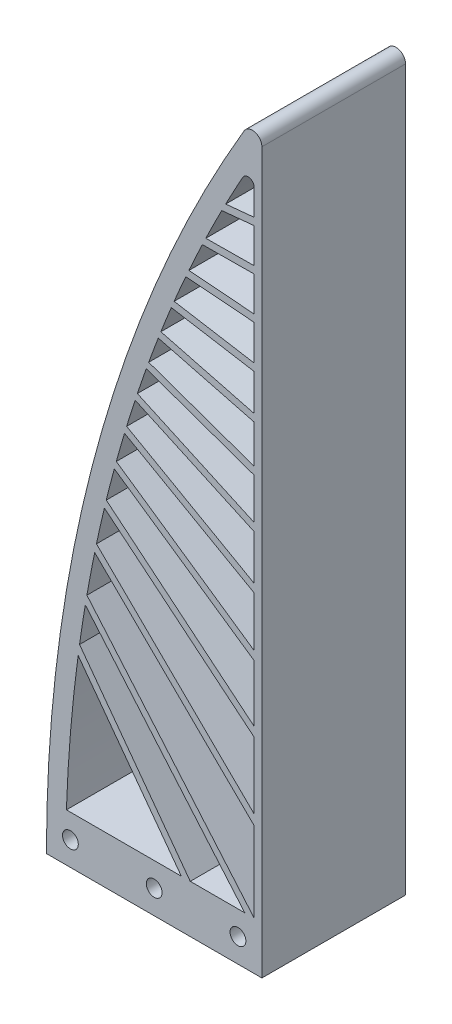
from build123d import *

# Parameters (mm, degrees)
BOSS_EXTRUDE4_DEPTH = 30
SKETCH12_R          = 1.65
CUT_EXTRUDE1_DEPTH  = 162.652709488
BOSS_EXTRUDE5_DEPTH = 30
CIRPATTERN1_DEPTH   = 30
CUT_EXTRUDE2_START  = -30
CUT_EXTRUDE2_DEPTH  = 30


# Read off the part's stored shape, not the designer's step: CirPattern1
with BuildPart() as part:
    # Sketch5 → Boss-Extrude4 (new body)
    with BuildSketch(Plane.XY):
        with BuildLine():
            Line((0, 0), (0, 150.337121164))
            ThreePointArc((0, 150.337121164), (-1.473777529, 152.266652173), (-3.723089911, 151.352483739))
            ThreePointArc((-3.723089911, 151.352483739), (-34.4957159, 78.440037035), (-45, 0))
            Line((-45, 0), (0, 0))
        make_face()
        with BuildLine():
            Line((-1.6, 10), (-40.829955095, 10))
            ThreePointArc((-40.829955095, 10), (-30.304470107, 78.595490327), (-4, 142.815440342))
            ThreePointArc((-4, 142.815440342), (-2.559389376, 143.433276944), (-1.6, 142.193658833))
            Line((-1.6, 142.193658833), (-1.6, 10))
        make_face(mode=Mode.SUBTRACT)
    extrude(amount=BOSS_EXTRUDE4_DEPTH)

    # Sketch12 → Cut-Extrude1 (cut, through all)
    with BuildSketch(Plane.XY.offset(30)):
        with Locations((-40, 5)):
            Circle(SKETCH12_R)
        with Locations((-22.5, 5)):
            Circle(SKETCH12_R)
        with Locations((-5, 5)):
            Circle(SKETCH12_R)
    extrude(amount=-CUT_EXTRUDE1_DEPTH, mode=Mode.SUBTRACT)

    # Sketch13 → Boss-Extrude5 (add)
    with BuildSketch(Plane.XY.offset(30)):
        Polygon((-101.6, 127.193658833), (-1.6, 10), (-2.741055234, 9.026350704), (-102.741055234, 126.220009537), align=None)
    extrude(amount=-BOSS_EXTRUDE5_DEPTH)

    # CirPattern1 outline → CirPattern1 (add)
    with BuildSketch(Plane.XY):
        with BuildLine():
            Line((-101.6, 127.193658833), (-90.428627174, 114.101518276))
            Line((-90.428627174, 114.101518276), (-38.303740092, 62.831561128))
            ThreePointArc((-38.303740092, 62.831561128), (-38.115676892, 63.697596098), (-37.925040114, 64.563068197))
            Line((-37.925040114, 64.563068197), (-89.330082385, 115.124987119))
            Line((-89.330082385, 115.124987119), (-36.32594483, 71.390938936))
            ThreePointArc((-36.32594483, 71.390938936), (-36.125817446, 72.197508487), (-35.923442521, 73.003517048))
            Line((-35.923442521, 73.003517048), (-88.324919079, 116.240305842))
            Line((-88.324919079, 116.240305842), (-34.318662851, 79.086385123))
            ThreePointArc((-34.318662851, 79.086385123), (-34.107234191, 79.850856393), (-33.893772384, 80.614762447))
            Line((-33.893772384, 80.614762447), (-87.420787154, 117.438986195))
            Line((-87.420787154, 117.438986195), (-32.265940677, 86.200502345))
            ThreePointArc((-32.265940677, 86.200502345), (-32.04280883, 86.93581789), (-31.817782431, 87.670555864))
            Line((-31.817782431, 87.670555864), (-86.624567601, 118.711905496))
            Line((-86.624567601, 118.711905496), (-30.142720205, 92.940380431))
            ThreePointArc((-30.142720205, 92.940380431), (-29.906617894, 93.656921246), (-29.668703058, 94.372862284))
            Line((-29.668703058, 94.372862284), (-85.942320131, 120.049376062))
            Line((-85.942320131, 120.049376062), (-27.915909182, 99.471216899))
            ThreePointArc((-27.915909182, 99.471216899), (-27.664777337, 100.177924555), (-27.411868402, 100.883998196))
            Line((-27.411868402, 100.883998196), (-85.379237059, 121.441218934))
            Line((-85.379237059, 121.441218934), (-25.542932289, 105.93724151))
            ThreePointArc((-25.542932289, 105.93724151), (-25.273841569, 106.642396064), (-25.002966495, 107.346867111))
            Line((-25.002966495, 107.346867111), (-84.939603787, 122.876841346))
            Line((-84.939603787, 122.876841346), (-22.968102286, 112.477173218))
            ThreePointArc((-22.968102286, 112.477173218), (-22.677026174, 113.189036497), (-22.384114637, 113.900146519))
            Line((-22.384114637, 113.900146519), (-84.62676619, 124.345317346))
            Line((-84.62676619, 124.345317346), (-20.11610645, 119.238472696))
            ThreePointArc((-20.11610645, 119.238472696), (-19.797493538, 119.965945777), (-19.476943816, 120.692567512))
            Line((-19.476943816, 120.692567512), (-84.443105151, 125.835470945))
            Line((-84.443105151, 125.835470945), (-16.880634523, 126.394117549))
            ThreePointArc((-16.880634523, 126.394117549), (-16.526645472, 127.147574571), (-16.170553887, 127.900040194))
            Line((-16.170553887, 127.900040194), (-84.390018442, 127.335961174))
            Line((-84.390018442, 127.335961174), (-13.103676665, 134.167087417))
            ThreePointArc((-13.103676665, 134.167087417), (-12.702778891, 134.959651729), (-12.299521655, 135.751018152))
            Line((-12.299521655, 135.751018152), (-101.6, 127.193658833))
        make_face()
        with BuildLine():
            Line((-102.741055234, 126.220009537), (-101.6, 127.193658833))
            Line((-101.6, 127.193658833), (-102.806194023, 126.301977287))
            Line((-102.806194023, 126.301977287), (-41.773547865, 43.741994606))
            ThreePointArc((-41.773547865, 43.741994606), (-41.616374453, 44.788813456), (-41.455485097, 45.835067632))
            Line((-41.455485097, 45.835067632), (-88.817221598, 109.902159449))
            Line((-88.817221598, 109.902159449), (-102.741055234, 126.220009537))
        make_face()
        with BuildLine():
            ThreePointArc((-34.552670054, 61.246010298), (-34.736897582, 60.374196024), (-34.918483062, 59.501827625))
            Line((-34.918483062, 59.501827625), (-1.6, 26.729819964))
            Line((-1.6, 26.729819964), (-1.6, 28.833815738))
            Line((-1.6, 28.833815738), (-34.552670054, 61.246010298))
        make_face()
        with BuildLine():
            ThreePointArc((-32.504088687, 70.182186635), (-32.701856665, 69.372354972), (-32.897328567, 68.561966034))
            Line((-32.897328567, 68.561966034), (-1.6, 42.738342848))
            Line((-1.6, 42.738342848), (-1.6, 44.683028154))
            Line((-1.6, 44.683028154), (-32.504088687, 70.182186635))
        make_face()
        with BuildLine():
            ThreePointArc((-30.409038425, 78.217419283), (-30.619276495, 77.451282634), (-30.827444392, 76.684580908))
            Line((-30.827444392, 76.684580908), (-1.6, 56.57738912))
            Line((-1.6, 56.57738912), (-1.6, 58.398072333))
            Line((-1.6, 58.398072333), (-30.409038425, 78.217419283))
        make_face()
        with BuildLine():
            ThreePointArc((-28.252621221, 85.651327492), (-28.475582862, 84.915412953), (-28.696619797, 84.178918027))
            Line((-28.696619797, 84.178918027), (-1.6, 68.831992526))
            Line((-1.6, 68.831992526), (-1.6, 70.555872953))
            Line((-1.6, 70.555872953), (-28.252621221, 85.651327492))
        make_face()
        with BuildLine():
            ThreePointArc((-26.008808525, 92.702926401), (-26.245713404, 91.98652139), (-26.480779611, 91.269510972))
            Line((-26.480779611, 91.269510972), (-1.6, 79.916914254))
            Line((-1.6, 79.916914254), (-1.6, 81.565680547))
            Line((-1.6, 81.565680547), (-26.008808525, 92.702926401))
        make_face()
        with BuildLine():
            ThreePointArc((-23.641877477, 99.547029874), (-23.894816729, 98.840967037), (-24.145954739, 98.134261515))
            Line((-24.145954739, 98.134261515), (-1.6, 90.138691265))
            Line((-1.6, 90.138691265), (-1.6, 91.730222742))
            Line((-1.6, 91.730222742), (-23.641877477, 99.547029874))
        make_face()
        with BuildLine():
            ThreePointArc((-21.104819389, 106.336831732), (-21.376834174, 105.63265906), (-21.647040774, 104.92779057))
            Line((-21.647040774, 104.92779057), (-1.6, 99.733471356))
            Line((-1.6, 99.733471356), (-1.6, 101.283005621))
            Line((-1.6, 101.283005621), (-21.104819389, 106.336831732))
        make_face()
        with BuildLine():
            ThreePointArc((-18.335117992, 113.220669335), (-18.63044525, 112.509971124), (-18.923911862, 111.798502583))
            Line((-18.923911862, 111.798502583), (-1.6, 108.891312509))
            Line((-1.6, 108.891312509), (-1.6, 110.412286949))
            Line((-1.6, 110.412286949), (-18.335117992, 113.220669335))
        make_face()
        with BuildLine():
            ThreePointArc((-15.247010957, 120.35771417), (-15.571555811, 119.631419453), (-15.8941351, 118.90424961))
            Line((-15.8941351, 118.90424961), (-1.6, 117.772685809))
            Line((-1.6, 117.772685809), (-1.6, 119.27737853))
            Line((-1.6, 119.27737853), (-15.247010957, 120.35771417))
        make_face()
        with BuildLine():
            ThreePointArc((-11.717737877, 127.936858719), (-12.079928782, 127.184359789), (-12.439981613, 126.430835503))
            Line((-12.439981613, 126.430835503), (-1.6, 126.520466904))
            Line((-1.6, 126.520466904), (-1.6, 128.020518181))
            Line((-1.6, 128.020518181), (-11.717737877, 127.936858719))
        make_face()
        with BuildLine():
            ThreePointArc((-7.562004039, 136.204998257), (-7.974393837, 135.412784341), (-8.384376146, 134.61932184))
            Line((-8.384376146, 134.61932184), (-1.6, 135.269445395))
            Line((-1.6, 135.269445395), (-1.6, 136.776316706))
            Line((-1.6, 136.776316706), (-7.562004039, 136.204998257))
        make_face()
        Polygon((0, 27.260058248), (0, 25.156062475), (7.181716143, 18.092137745), (8.23357019, 19.161531528), align=None)
        Polygon((0, 136.929639232), (0, 135.422767921), (51.900153262, 140.396182044), (51.757068846, 141.889342065), align=None)
        Polygon((0, 128.03374793), (0, 126.533696654), (52.466714553, 126.967522588), (52.454312086, 128.467471313), align=None)
        Polygon((0, 119.150718045), (0, 117.646025324), (51.860735117, 113.540584165), (51.979108991, 115.035906079), align=None)
        Polygon((0, 110.143784999), (0, 108.622810558), (50.086826826, 100.217553884), (50.335076143, 101.696868684), align=None)
        Polygon((0, 100.868435169), (0, 99.318900904), (47.158490191, 87.099828051), (47.534725625, 88.551877257), align=None)
        Polygon((0, 91.162807764), (0, 89.571276287), (43.098011623, 74.287240479), (43.599369795, 75.700973121), align=None)
        Polygon((0, 80.835632895), (0, 79.186866601), (37.936293815, 61.877302697), (38.558959087, 63.241959415), align=None)
        Polygon((0, 69.649668379), (0, 67.925787952), (31.712620558, 49.964461824), (32.451854069, 51.269656757), align=None)
        Polygon((0, 57.297342949), (0, 55.476659736), (24.474357761, 38.639381772), (25.3245335, 39.875181599), align=None)
        Polygon((0, 43.362858063), (0, 41.418172757), (16.276592976, 27.988253239), (17.231240592, 29.145252777), align=None)
        with BuildLine():
            Line((-16.829705211, 10), (-14.964333673, 10))
            Line((-14.964333673, 10), (-38.088693922, 41.280747301))
            ThreePointArc((-38.088693922, 41.280747301), (-38.23738412, 40.217865998), (-38.382194992, 39.154449216))
            Line((-38.382194992, 39.154449216), (-16.829705211, 10))
        make_face()
    extrude(amount=CIRPATTERN1_DEPTH)

    # Sketch14 → Cut-Extrude2 (cut)
    with BuildSketch(Plane.XY.offset(30).offset(CUT_EXTRUDE2_START)):
        Polygon((-129.094046134, -17.289617226), (770.905953866, -20.358672888), (773.974831033, 879.588983489), (-141.374926706, 882.710382774), align=None)
        with BuildLine():
            Line((-45, 0), (0, 0))
            Line((0, 0), (0, 150.337121164))
            ThreePointArc((0, 150.337121164), (-1.473777529, 152.266652173), (-3.723089911, 151.352483739))
            ThreePointArc((-3.723089911, 151.352483739), (-34.4957159, 78.440037035), (-45, 0))
        make_face(mode=Mode.SUBTRACT)
    extrude(amount=CUT_EXTRUDE2_DEPTH, mode=Mode.SUBTRACT)


solid = part.part
